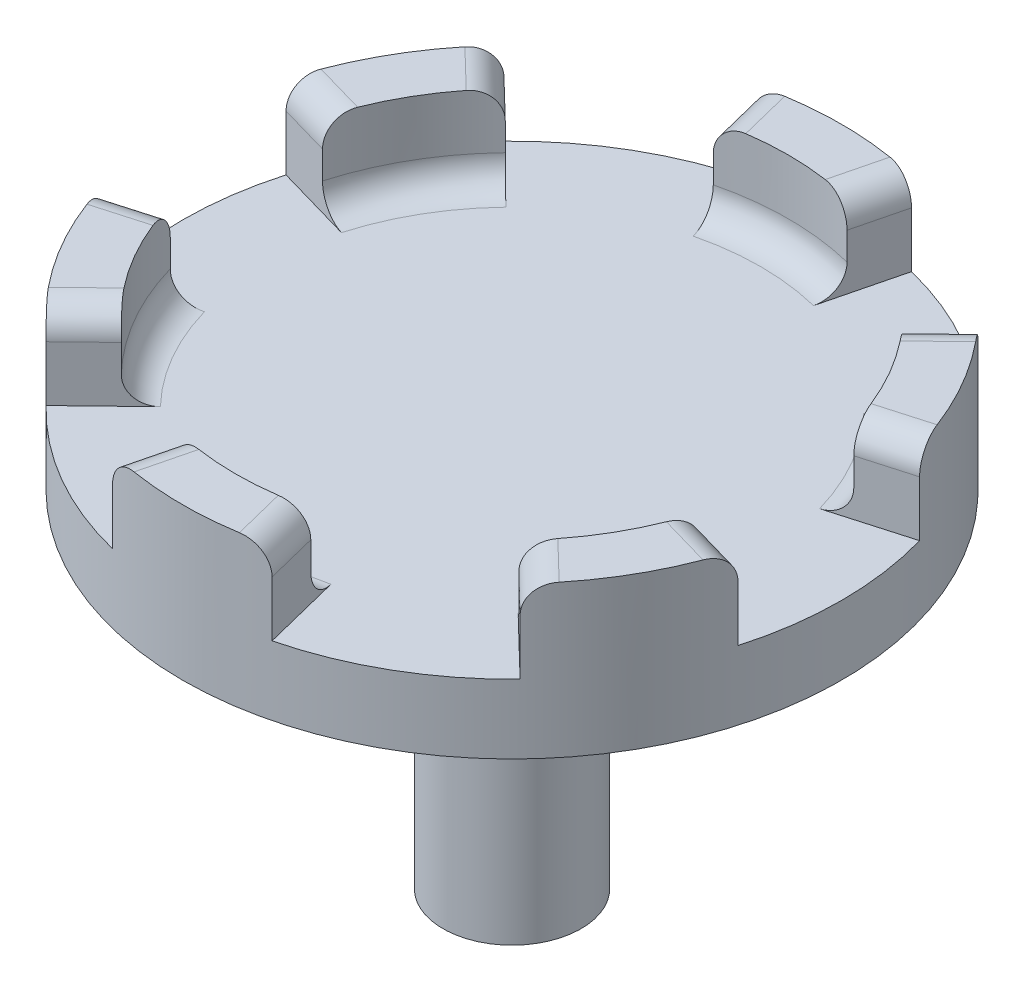
from build123d import *

# Parameters (mm, degrees)
SKETCH1_R           = 30.2895
BOSS_EXTRUDE1_DEPTH = 6.35
BOSS_EXTRUDE2_DEPTH = 7.62
FILLET1_R           = 2.54
SKETCH3_R           = 8.89
BOSS_EXTRUDE3_DEPTH = 6.35
FILLET2_R           = 2.54
SKETCH4_R           = 6.35
BOSS_EXTRUDE4_DEPTH = 25.4


with BuildPart() as part:
    # Sketch1 → Boss-Extrude1 (new body)
    with BuildSketch(Plane(origin=(0, 0, 0), x_dir=(1, 0, 0), z_dir=(0, 1, 0))):
        Circle(SKETCH1_R)
    extrude(amount=BOSS_EXTRUDE1_DEPTH)

    # Sketch2 → Boss-Extrude2 (add)
    with BuildSketch(Plane(origin=(0, 6.35, 0), x_dir=(1, 0, 0), z_dir=(0, 1, 0))):
        with BuildLine():
            ThreePointArc((6.148158832, -24.644677782), (0, -25.4), (-6.148158832, -24.644677782))
            Line((-6.148158832, -24.644677782), (-7.331679408, -29.388778255))
            ThreePointArc((-7.331679408, -29.388778255), (0, -30.2895), (7.331679408, -29.388778255))
            Line((7.331679408, -29.388778255), (6.148158832, -24.644677782))
        make_face()
        with BuildLine():
            ThreePointArc((-29.117268259, -8.344968508), (-26.231476468, -15.14475), (-21.785588851, -21.043809747))
            Line((-21.785588851, -21.043809747), (-18.268837611, -17.646800626))
            ThreePointArc((-18.268837611, -17.646800626), (-21.997045256, -12.7), (-24.416996443, -6.997877156))
            Line((-24.416996443, -6.997877156), (-29.117268259, -8.344968508))
        make_face()
        with BuildLine():
            Line((18.268837611, -17.646800626), (21.785588851, -21.043809747))
            ThreePointArc((21.785588851, -21.043809747), (26.231476468, -15.14475), (29.117268259, -8.344968508))
            Line((29.117268259, -8.344968508), (24.416996443, -6.997877156))
            ThreePointArc((24.416996443, -6.997877156), (21.997045256, -12.7), (18.268837611, -17.646800626))
        make_face()
        with BuildLine():
            ThreePointArc((-21.785588851, 21.043809747), (-26.231476468, 15.14475), (-29.117268259, 8.344968508))
            Line((-29.117268259, 8.344968508), (-24.416996443, 6.997877156))
            ThreePointArc((-24.416996443, 6.997877156), (-21.997045256, 12.7), (-18.268837611, 17.646800626))
            Line((-18.268837611, 17.646800626), (-21.785588851, 21.043809747))
        make_face()
        with BuildLine():
            Line((24.416996443, 6.997877156), (29.117268259, 8.344968508))
            ThreePointArc((29.117268259, 8.344968508), (26.231476468, 15.14475), (21.785588851, 21.043809747))
            Line((21.785588851, 21.043809747), (18.268837611, 17.646800626))
            ThreePointArc((18.268837611, 17.646800626), (21.997045256, 12.7), (24.416996443, 6.997877156))
        make_face()
        with BuildLine():
            ThreePointArc((7.331679408, 29.388778255), (0, 30.2895), (-7.331679408, 29.388778255))
            Line((-7.331679408, 29.388778255), (-6.148158832, 24.644677782))
            ThreePointArc((-6.148158832, 24.644677782), (0, 25.4), (6.148158832, 24.644677782))
            Line((6.148158832, 24.644677782), (7.331679408, 29.388778255))
        make_face()
    extrude(amount=BOSS_EXTRUDE2_DEPTH)

    # Fillet1
    fillet1_edges = [part.edges().sort_by_distance(p)[0] for p in [
        (26.767132351, 13.97, 7.671422832),
        (26.767132351, 13.97, -7.671422832),
        (20.027213231, 13.97, -19.345305187),
        (6.73991912, 13.97, -27.016728018),
        (-6.73991912, 13.97, -27.016728018),
        (-20.027213231, 13.97, -19.345305187),
        (-26.767132351, 13.97, -7.671422832),
        (-26.767132351, 13.97, 7.671422832),
        (-20.027213231, 13.97, 19.345305187),
        (-6.73991912, 13.97, 27.016728018),
        (20.027213231, 13.97, 19.345305187),
        (6.73991912, 13.97, 27.016728018),
    ]]
    fillet(fillet1_edges, radius=FILLET1_R)

    # Sketch3 → Boss-Extrude3 (add)
    with BuildSketch(Plane.XZ):
        Circle(SKETCH3_R)
    extrude(amount=BOSS_EXTRUDE3_DEPTH)

    # Fillet2
    fillet2_edges = [part.edges().sort_by_distance(p)[0] for p in [
        (-21.997045256, 6.35, 12.7),
        (-21.997045256, 6.35, -12.7),
        (0, 6.35, -25.4),
        (21.997045256, 6.35, -12.7),
        (0, 6.35, 25.4),
        (21.997045256, 6.35, 12.7),
    ]]
    fillet(fillet2_edges, radius=FILLET2_R)

    # Sketch4 → Boss-Extrude4 (add)
    with BuildSketch(Plane.XZ.offset(6.35)):
        Circle(SKETCH4_R)
    extrude(amount=BOSS_EXTRUDE4_DEPTH)


solid = part.part
